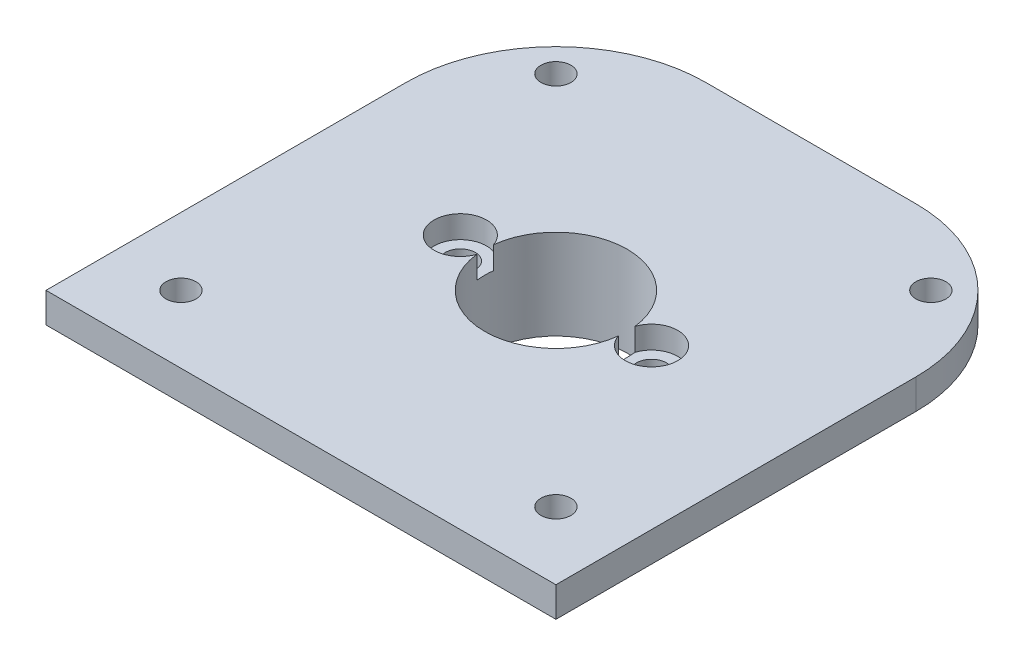
from build123d import *

# Parameters (mm, degrees)
SKETCH1_W           = 68
SKETCH1_H           = 68
SKETCH1_R           = 2
SKETCH1_R_2         = 9.5
BOSS_EXTRUDE1_DEPTH = 4
BOSS_EXTRUDE2_START = 8
SKETCH2_R           = 19
SKETCH2_R_2         = 9.5
SKETCH2_R_3         = 2
BOSS_EXTRUDE2_DEPTH = 8
SKETCH3_R           = 3.5
CUT_EXTRUDE1_DEPTH  = 3
FILLET1_R           = 20


with BuildPart() as part:
    # Sketch1 → Boss-Extrude1 (new body)
    with BuildSketch(Plane(origin=(0, 0, 0), x_dir=(1, 0, 0), z_dir=(0, 1, 0))):
        with Locations((34, 34)):
            Rectangle(SKETCH1_W, SKETCH1_H)
        with Locations((59, 59)):
            Circle(SKETCH1_R, mode=Mode.SUBTRACT)
        with Locations((59, 9)):
            Circle(SKETCH1_R, mode=Mode.SUBTRACT)
        with Locations((9, 9)):
            Circle(SKETCH1_R, mode=Mode.SUBTRACT)
        with Locations((9, 59)):
            Circle(SKETCH1_R, mode=Mode.SUBTRACT)
        with Locations((21.25, 34)):
            Circle(SKETCH1_R, mode=Mode.SUBTRACT)
        with Locations((46.75, 34)):
            Circle(SKETCH1_R, mode=Mode.SUBTRACT)
        with Locations((34, 34)):
            Circle(SKETCH1_R_2, mode=Mode.SUBTRACT)
    extrude(amount=BOSS_EXTRUDE1_DEPTH)

    # Sketch2 → Boss-Extrude2 (add)
    with BuildSketch(Plane.XZ.offset(BOSS_EXTRUDE2_START)):
        with Locations((34, -34)):
            Circle(SKETCH2_R)
        with Locations((34, -34)):
            Circle(SKETCH2_R_2, mode=Mode.SUBTRACT)
        with Locations((46.75, -34)):
            Circle(SKETCH2_R_3, mode=Mode.SUBTRACT)
        with Locations((21.25, -34)):
            Circle(SKETCH2_R_3, mode=Mode.SUBTRACT)
    extrude(amount=-BOSS_EXTRUDE2_DEPTH)

    # Sketch3 → Cut-Extrude1 (cut)
    with BuildSketch(Plane(origin=(0, 4, 0), x_dir=(1, 0, 0), z_dir=(0, 1, 0))):
        with Locations((21.25, 34)):
            Circle(SKETCH3_R)
        with Locations((46.75, 34)):
            Circle(SKETCH3_R)
    extrude(amount=-CUT_EXTRUDE1_DEPTH, mode=Mode.SUBTRACT)

    # Fillet1
    fillet1_edges = [part.edges().sort_by_distance(p)[0] for p in [
        (68, 2, -68),
        (0, 2, -68),
    ]]
    fillet(fillet1_edges, radius=FILLET1_R)


solid = part.part
